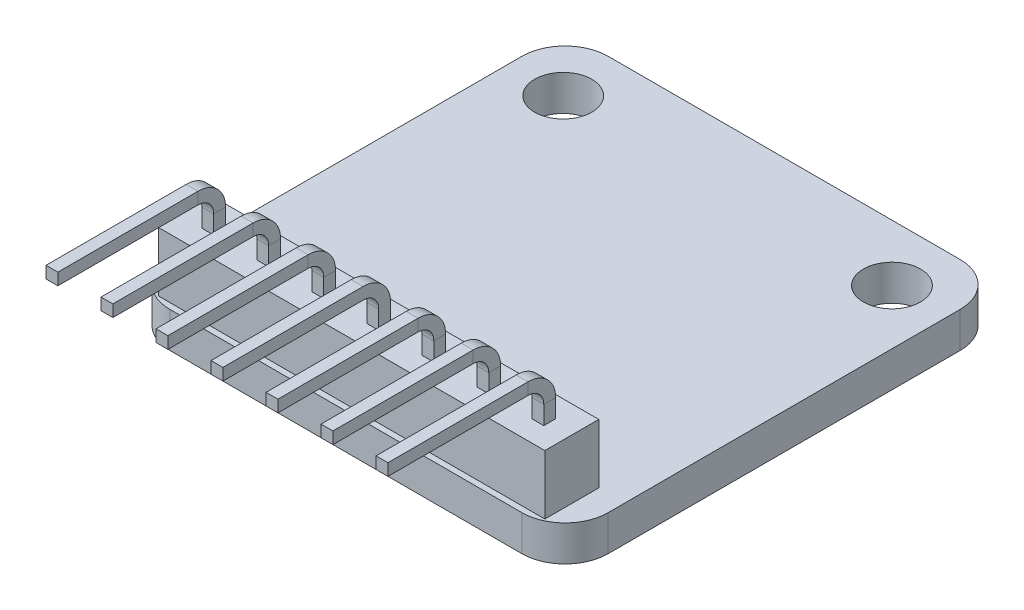
from build123d import *

# Parameters (mm, degrees)
SKETCH2_W            = 20.32
SKETCH2_H            = 20.32
SKETCH2_R            = 1.325
BOSS_EXTRUDE1_DEPTH  = 1.65
SKETCH3_W            = 0.55
SKETCH3_H            = 0.55
LPATTERN1_COUNT      = 4
LPATTERN1_PITCH      = 2.55
LPATTERN1_COUNT_DIR2 = 4
LPATTERN1_PITCH_DIR2 = 2.55
SKETCH5_W            = 17.9
SKETCH5_H            = 2.5
BOSS_EXTRUDE2_DEPTH  = 2.75
SKETCH6_W            = 2
SKETCH6_H            = 2.5
SKETCH6_W_2          = 2.5
SKETCH6_H_2          = 3.5
BOSS_EXTRUDE3_DEPTH  = 0.5
FILLET1_R            = 2
SKETCH7_W            = 1.7
SKETCH7_H            = 2.7
CUT_EXTRUDE1_DEPTH   = 0.1


with BuildPart() as part:
    # Sketch2 → Boss-Extrude1 (new body)
    with BuildSketch(Plane(origin=(0, 0, 0), x_dir=(1, 0, 0), z_dir=(0, 1, 0))):
        with Locations((10.16, 10.16)):
            Rectangle(SKETCH2_W, SKETCH2_H)
        with Locations((2.54, 17.695)):
            Circle(SKETCH2_R, mode=Mode.SUBTRACT)
        with Locations((17.78, 17.695)):
            Circle(SKETCH2_R, mode=Mode.SUBTRACT)
    extrude(amount=BOSS_EXTRUDE1_DEPTH)

    # Sweep1: sweep along a path in Sketch4
    with BuildLine(Plane(origin=(0, 0, 0), x_dir=(0, 0, -1), z_dir=(1, 0, 0))) as sweep1_path:
        Line((1.524, 1.65), (1.524, 5.25))
        ThreePointArc((1.524, 5.25), (1.231106781, 5.957106781), (0.524, 6.25))
        Line((0.524, 6.25), (-5.976, 6.25))
    # Sketch3 → Sweep1 (sweep)
    with BuildSketch(Plane(origin=(0, 1.65, 0), x_dir=(1, 0, 0), z_dir=(0, 1, 0))):
        with Locations((10.16, 1.524)):
            Rectangle(SKETCH3_W, SKETCH3_H)
    sweep1 = sweep(path=sweep1_path.line)

    # LPattern1: Sweep1 4 × 4
    with Locations(*[Vector(-1, 0, 0) * (i * LPATTERN1_PITCH) + Vector(1, 0, 0) * (j * LPATTERN1_PITCH_DIR2) for i in range(LPATTERN1_COUNT) for j in range(LPATTERN1_COUNT_DIR2) if (i, j) != (0, 0)]):
        add(sweep1)

    # Sketch5 → Boss-Extrude2 (add)
    with BuildSketch(Plane(origin=(0, 1.65, 0), x_dir=(1, 0, 0), z_dir=(0, 1, 0))):
        with Locations((10.16, 1.524)):
            Rectangle(SKETCH5_W, SKETCH5_H)
    extrude(amount=BOSS_EXTRUDE2_DEPTH)

    # Sketch6 → Boss-Extrude3 (add)
    with BuildSketch(Plane.XZ):
        with Locations((9.906, -9.906)):
            Rectangle(SKETCH6_W, SKETCH6_H)
        with Locations((13.208, -10.406)):
            Rectangle(SKETCH6_W_2, SKETCH6_H_2)
    extrude(amount=BOSS_EXTRUDE3_DEPTH)

    # Fillet1
    fillet1_edges = [part.edges().sort_by_distance(p)[0] for p in [
        (0, 0.825, 0),
        (0, 0.825, -20.32),
        (20.32, 0.825, -20.32),
        (20.32, 0.825, 0),
    ]]
    fillet(fillet1_edges, radius=FILLET1_R)

    # Sketch7 → Cut-Extrude1 (cut)
    with BuildSketch(Plane.XZ.offset(0.5)):
        with Locations((13.208, -10.406)):
            Rectangle(SKETCH7_W, SKETCH7_H)
    extrude(amount=-CUT_EXTRUDE1_DEPTH, mode=Mode.SUBTRACT)


solid = part.part
